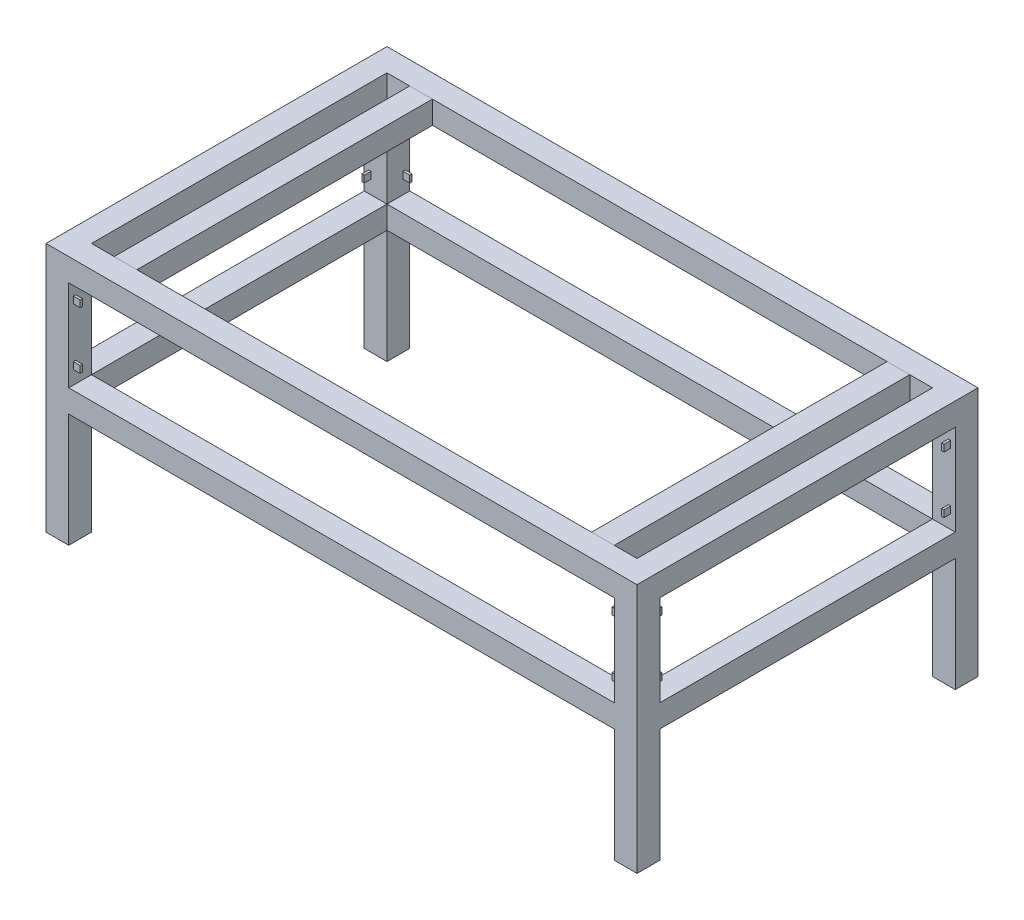
from build123d import *

# Parameters (mm, degrees)
ESQUISSE1_W             = 1300
ESQUISSE1_H             = 750
ESQUISSE1_W_2           = 1200
ESQUISSE1_H_2           = 650
BOSS_EXTRU_1_DEPTH      = 550
ESQUISSE2_W             = 1200
ESQUISSE2_H             = 200
ESQUISSE2_H_2           = 250
ENL_V_MAT_EXTRU_1_DEPTH = 1599.436736315
ESQUISSE3_W             = 650
ESQUISSE3_H             = 200
ESQUISSE3_H_2           = 250
ENL_V_MAT_EXTRU_2_DEPTH = 1599.436736315
ESQUISSE4_W             = 50
ESQUISSE4_H             = 650
BOSS_EXTRU_2_DEPTH      = 50
BOSS_EXTRU_2_2_DEPTH    = 50
ESQUISSE5_W             = 5
ESQUISSE5_H             = 15
BOSS_EXTRU_3_DEPTH      = 15
ESQUISSE6_W             = 5
ESQUISSE6_H             = 15
BOSS_EXTRU_4_DEPTH      = 15
ESQUISSE7_W             = 5
ESQUISSE7_H             = 15
BOSS_EXTRU_5_DEPTH      = 15
ESQUISSE8_W             = 5
ESQUISSE8_H             = 15
BOSS_EXTRU_6_DEPTH      = 15
ESQUISSE10_W            = 5
ESQUISSE10_H            = 15
BOSS_EXTRU_7_DEPTH      = 15
ESQUISSE12_W            = 5
ESQUISSE12_H            = 15
BOSS_EXTRU_8_DEPTH      = 15
ESQUISSE14_W            = 5
ESQUISSE14_H            = 15
BOSS_EXTRU_9_DEPTH      = 15
ESQUISSE15_W            = 5
ESQUISSE15_H            = 15
BOSS_EXTRU_10_DEPTH     = 15


with BuildPart() as part:
    # Esquisse1 → Boss.-Extru.1 (new body)
    with BuildSketch(Plane(origin=(0, 0, 0), x_dir=(1, 0, 0), z_dir=(0, 1, 0))):
        with Locations((650, 375)):
            Rectangle(ESQUISSE1_W, ESQUISSE1_H)
        with Locations((650, 375)):
            Rectangle(ESQUISSE1_W_2, ESQUISSE1_H_2, mode=Mode.SUBTRACT)
    extrude(amount=-BOSS_EXTRU_1_DEPTH)

    # Esquisse2 → Enlèv. mat.-Extru.1 (cut, through all)
    with BuildSketch(Plane.XY):
        with Locations((650, -150)):
            Rectangle(ESQUISSE2_W, ESQUISSE2_H)
        with Locations((650, -425)):
            Rectangle(ESQUISSE2_W, ESQUISSE2_H_2)
    extrude(amount=-ENL_V_MAT_EXTRU_1_DEPTH, mode=Mode.SUBTRACT)

    # Esquisse3 → Enlèv. mat.-Extru.2 (cut, through all)
    with BuildSketch(Plane.ZY):
        with Locations((-375, -150)):
            Rectangle(ESQUISSE3_W, ESQUISSE3_H)
        with Locations((-375, -425)):
            Rectangle(ESQUISSE3_W, ESQUISSE3_H_2)
    extrude(amount=-ENL_V_MAT_EXTRU_2_DEPTH, mode=Mode.SUBTRACT)

    # Esquisse5 → Boss.-Extru.3 (add)
    with BuildSketch(Plane.ZY.offset(-1250)):
        with Locations((-737.5, -87.5)):
            Rectangle(ESQUISSE5_W, ESQUISSE5_H)
        with Locations((-737.5, -212.5)):
            Rectangle(ESQUISSE5_W, ESQUISSE5_H)
    extrude(amount=BOSS_EXTRU_3_DEPTH)

    # Esquisse6 → Boss.-Extru.4 (add)
    with BuildSketch(Plane.XY.offset(-700)):
        with Locations((1287.5, -87.5)):
            Rectangle(ESQUISSE6_W, ESQUISSE6_H)
        with Locations((1287.5, -212.5)):
            Rectangle(ESQUISSE6_W, ESQUISSE6_H)
    extrude(amount=BOSS_EXTRU_4_DEPTH)

    # Esquisse7 → Boss.-Extru.5 (add)
    with BuildSketch(Plane(origin=(50, 0, 0), x_dir=(0, 0, -1), z_dir=(1, 0, 0))):
        with Locations((737.5, -87.5)):
            Rectangle(ESQUISSE7_W, ESQUISSE7_H)
        with Locations((737.5, -212.5)):
            Rectangle(ESQUISSE7_W, ESQUISSE7_H)
    extrude(amount=BOSS_EXTRU_5_DEPTH)

    # Esquisse8 → Boss.-Extru.6 (add)
    with BuildSketch(Plane.XY.offset(-700)):
        with Locations((12.5, -87.5)):
            Rectangle(ESQUISSE8_W, ESQUISSE8_H)
        with Locations((12.5, -212.5)):
            Rectangle(ESQUISSE8_W, ESQUISSE8_H)
    extrude(amount=BOSS_EXTRU_6_DEPTH)

    # Esquisse10 → Boss.-Extru.7 (add)
    with BuildSketch(Plane(origin=(50, 0, 0), x_dir=(0, 0, -1), z_dir=(1, 0, 0))):
        with Locations((12.5, -87.5)):
            Rectangle(ESQUISSE10_W, ESQUISSE10_H)
        with Locations((12.5, -212.5)):
            Rectangle(ESQUISSE10_W, ESQUISSE10_H)
    extrude(amount=BOSS_EXTRU_7_DEPTH)

    # Esquisse12 → Boss.-Extru.8 (add)
    with BuildSketch(Plane(origin=(0, 0, -50), x_dir=(-1, 0, 0), z_dir=(0, 0, -1))):
        with Locations((-12.5, -87.5)):
            Rectangle(ESQUISSE12_W, ESQUISSE12_H)
        with Locations((-12.5, -212.5)):
            Rectangle(ESQUISSE12_W, ESQUISSE12_H)
    extrude(amount=BOSS_EXTRU_8_DEPTH)

    # Esquisse14 → Boss.-Extru.9 (add)
    with BuildSketch(Plane.ZY.offset(-1250)):
        with Locations((-12.5, -87.5)):
            Rectangle(ESQUISSE14_W, ESQUISSE14_H)
        with Locations((-12.5, -212.5)):
            Rectangle(ESQUISSE14_W, ESQUISSE14_H)
    extrude(amount=BOSS_EXTRU_9_DEPTH)

    # Esquisse15 → Boss.-Extru.10 (add)
    with BuildSketch(Plane(origin=(0, 0, -50), x_dir=(-1, 0, 0), z_dir=(0, 0, -1))):
        with Locations((-1287.5, -87.5)):
            Rectangle(ESQUISSE15_W, ESQUISSE15_H)
        with Locations((-1287.5, -212.5)):
            Rectangle(ESQUISSE15_W, ESQUISSE15_H)
    extrude(amount=BOSS_EXTRU_10_DEPTH)


with BuildPart() as body_2:
    # Esquisse4 → Boss.-Extru.2 (new body)
    with BuildSketch(Plane(origin=(0, 0, 0), x_dir=(1, 0, 0), z_dir=(0, 1, 0))):
        with Locations((125, 375)):
            Rectangle(ESQUISSE4_W, ESQUISSE4_H)
    extrude(amount=-BOSS_EXTRU_2_DEPTH)


with BuildPart() as body_3:
    # Esquisse4 → Boss.-Extru.2 2 (new body)
    with BuildSketch(Plane(origin=(0, 0, 0), x_dir=(1, 0, 0), z_dir=(0, 1, 0))):
        with Locations((1175, 375)):
            Rectangle(ESQUISSE4_W, ESQUISSE4_H)
    extrude(amount=-BOSS_EXTRU_2_2_DEPTH)


solid = Compound([part.part, body_2.part, body_3.part])
